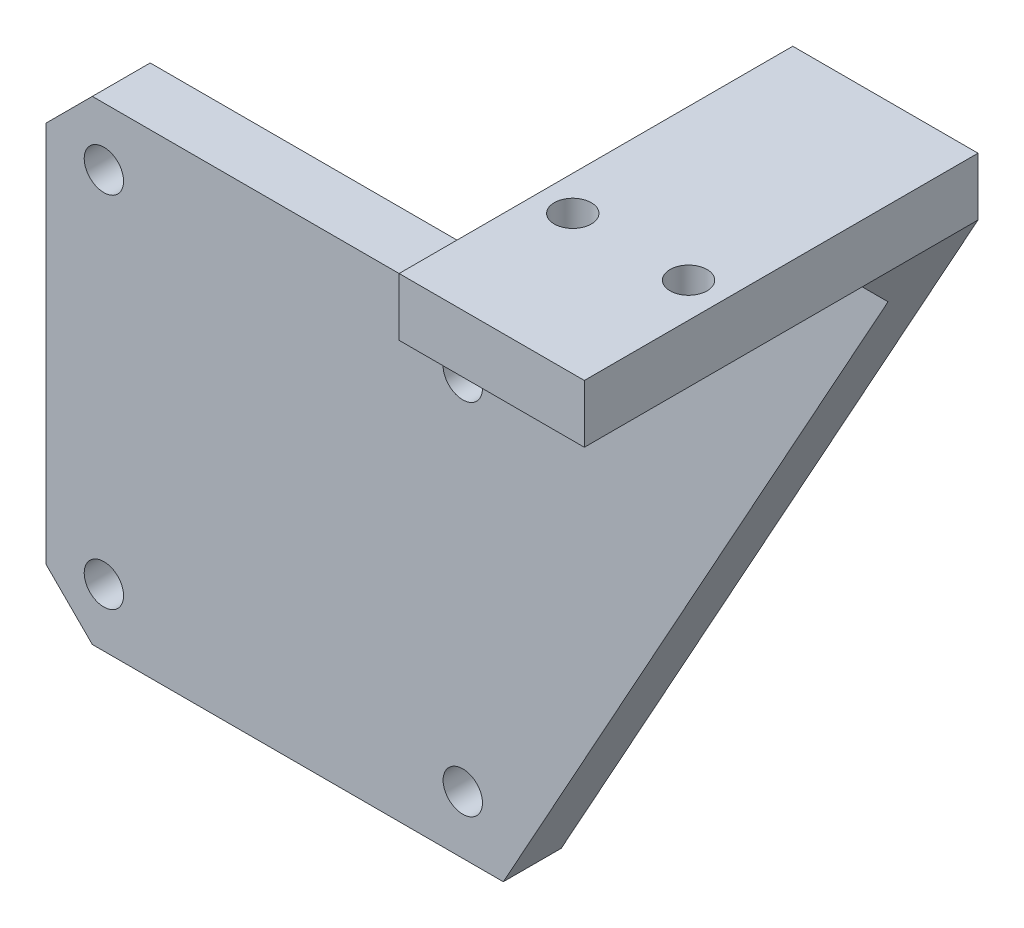
from build123d import *

# Parameters (mm, degrees)
P_IDAT_VYSUNUT_M1_DEPTH   = 4.999999888
ODEBRAT_VYSUNUT_M1_DEPTH  = 84.910666461
SKICA3_W                  = 16.00000076
SKICA3_H                  = 5.000002682
P_IDAT_VYSUNUT_M2_DEPTH   = 20
ODEBRAT_VYSUNUT_M3_DEPTH  = 87.116200856
ODEBRAT_VYSUNUT_M4_DEPTH  = 87.116200856
ODEBRAT_VYSUNUT_M5_DEPTH  = 87.116200856
ODEBRAT_VYSUNUT_M6_DEPTH  = 87.116200856
ZKOSEN_1_SIZE             = 4.000000656
ZKOSEN_2_SIZE             = 4.999998957
ZKOSEN_2_SIZE_2           = 4.999999888
ZKOSEN_3_SIZE             = 3.999999976
ZKOSEN_3_SIZE2            = 4.000000587
SKICA11_R                 = 1.7
ODEBRAT_VYSUNUT_M9_DEPTH  = 10
SKICA12_W                 = 16.00000076
SKICA12_H                 = 5.000002682
P_IDAT_VYSUNUT_M3_DEPTH   = 9
SKICA10_R                 = 1.6
SKICA10_R_2               = 1.599999993
ODEBRAT_VYSUNUT_M10_DEPTH = 9


with BuildPart() as part:
    # Skica1 → Přidat vysunutím1 (new body)
    with BuildSketch(Plane.XY.offset(4.999999888)):
        Polygon((45.999998971, 70.000000298), (-29.500000179, 70.000000298), (-29.500000179, 6.8e-07), (9.999999776, 6.8e-07), (45.999998971, 64.999998915), align=None)
    extrude(amount=-P_IDAT_VYSUNUT_M1_DEPTH)

    # Skica2 → Odebrat vysunutím1 (cut, through all)
    with BuildSketch(Plane.XY.offset(4.999999888)):
        Polygon((25.833334774, 59.999998659), (30.000000641, 64.999996523), (30.000000641, 70.000000298), (-29.500000179, 70.000000298), (-29.500000179, 41.000001132), (9.999999776, 41.000001132), align=None)
    extrude(amount=-ODEBRAT_VYSUNUT_M1_DEPTH, mode=Mode.SUBTRACT)

    # Skica3 → Přidat vysunutím2 (add)
    with BuildSketch(Plane.XY.offset(4.999999888)):
        with Locations((37.999999709, 67.499998957)):
            Rectangle(SKICA3_W, SKICA3_H)
    extrude(amount=P_IDAT_VYSUNUT_M2_DEPTH)

    # Skica5 → Odebrat vysunutím3 (cut, through all)
    with BuildSketch(Plane.XY.offset(4.999999888)):
        Polygon((-23.097474128, 4.468092229), (-23.010937497, 4.819194786), (-23.010937497, 5.180804525), (-23.097474128, 5.531907082), (-23.265523836, 5.85209718), (-23.505315185, 6.122766063), (-23.802915588, 6.328184158), (-24.141026661, 6.456412841), (-24.499999359, 6.500000134), (-24.85897392, 6.456412841), (-25.197084993, 6.328184158), (-25.494683534, 6.122766063), (-25.734476745, 5.85209718), (-25.90252459, 5.531907082), (-25.989063084, 5.180804525), (-25.989063084, 4.819194786), (-25.90252459, 4.468092229), (-25.734476745, 4.147903062), (-25.494683534, 3.877233714), (-25.197084993, 3.671815852), (-24.85897392, 3.543587169), (-24.499999359, 3.500000108), (-24.141026661, 3.543587169), (-23.802915588, 3.671815852), (-23.505315185, 3.877233714), (-23.265523836, 4.147903062), align=None)
    extrude(amount=-ODEBRAT_VYSUNUT_M3_DEPTH, mode=Mode.SUBTRACT)

    # Skica6 → Odebrat vysunutím4 (cut, through all)
    with BuildSketch(Plane.XY.offset(4.999999888)):
        Polygon((5.505315959, 3.877233714), (5.802914966, 3.671815852), (6.141026504, 3.543587169), (6.500000134, 3.500000108), (6.858973298, 3.543587169), (7.197084371, 3.671815852), (7.494683843, 3.877233714), (7.734475657, 4.147903062), (7.902524434, 4.468092229), (7.989062928, 4.819194786), (7.989062928, 5.180804525), (7.902524434, 5.531907082), (7.734475657, 5.85209718), (7.494683843, 6.122766063), (7.197084371, 6.328184158), (6.858973298, 6.456412841), (6.500000134, 6.500000134), (6.141026504, 6.456412841), (5.802914966, 6.328184158), (5.505315959, 6.122766063), (5.26552368, 5.85209718), (5.097475369, 5.531907082), (5.010936875, 5.180804525), (5.010936875, 4.819194786), (5.097475369, 4.468092229), (5.26552368, 4.147903062), align=None)
    extrude(amount=-ODEBRAT_VYSUNUT_M4_DEPTH, mode=Mode.SUBTRACT)

    # Skica7 → Odebrat vysunutím5 (cut, through all)
    with BuildSketch(Plane.XY.offset(4.999999888)):
        Polygon((-23.377234116, 35.005312413), (-23.171816021, 35.302914679), (-23.043585941, 35.641025752), (-23.000000045, 35.99999845), (-23.043585941, 36.358974874), (-23.171816021, 36.697082222), (-23.377234116, 36.994680762), (-23.647902533, 37.234473974), (-23.968091235, 37.402521819), (-24.319194257, 37.489064038), (-24.680804461, 37.489064038), (-25.031907484, 37.402521819), (-25.352096185, 37.234473974), (-25.622766465, 36.994680762), (-25.82818456, 36.697082222), (-25.956412777, 36.358974874), (-26.000000536, 35.99999845), (-25.956412777, 35.641025752), (-25.82818456, 35.302914679), (-25.622766465, 35.005312413), (-25.352096185, 34.765522927), (-25.031907484, 34.597471356), (-24.680804461, 34.510936588), (-24.319194257, 34.510936588), (-23.968091235, 34.597471356), (-23.647902533, 34.765522927), align=None)
    extrude(amount=-ODEBRAT_VYSUNUT_M5_DEPTH, mode=Mode.SUBTRACT)

    # Skica8 → Odebrat vysunutím6 (cut, through all)
    with BuildSketch(Plane.XY.offset(4.999999888)):
        Polygon((5.968092475, 34.597471356), (6.319194566, 34.510936588), (6.68080477, 34.510936588), (7.031906862, 34.597471356), (7.35209696, 34.765522927), (7.622765843, 35.005312413), (7.828184403, 35.302914679), (7.956412621, 35.641025752), (8.00000038, 35.99999845), (7.956412621, 36.358974874), (7.828184403, 36.697082222), (7.622765843, 36.994680762), (7.35209696, 37.234473974), (7.031906862, 37.402521819), (6.68080477, 37.489064038), (6.319194566, 37.489064038), (5.968092475, 37.402521819), (5.647902843, 37.234473974), (5.377233494, 36.994680762), (5.171815865, 36.697082222), (5.043587182, 36.358974874), (4.999999888, 35.99999845), (5.043587182, 35.641025752), (5.171815865, 35.302914679), (5.377233494, 35.005312413), (5.647902843, 34.765522927), align=None)
    extrude(amount=-ODEBRAT_VYSUNUT_M6_DEPTH, mode=Mode.SUBTRACT)

    # Zkosení1
    zkosen_1_edges = [part.edges().sort_by_distance(p)[0] for p in [
        (-29.500000179, 41.000001132, 2.499999944),
    ]]
    chamfer(zkosen_1_edges, length=ZKOSEN_1_SIZE)

    # Zkosení2
    # the kernel refuses this chamfer: 4.999999888, 4.999998957 mm, written as the material it adds along each edge
    with BuildSketch(Plane(origin=(58.858412936, 64.999997616, 4.999999888), x_dir=(0, -0.999621916702082, -0.027495884216655726), z_dir=(-1, 0, 0))) as zkosen_2_piece_1_section:
        Polygon((ZKOSEN_2_SIZE * 0.999621916686, ZKOSEN_2_SIZE * 0.0274958842162), (-ZKOSEN_2_SIZE_2 * 0.027495884218, ZKOSEN_2_SIZE_2 * 0.99962191675), (0, 0), align=None)
    zkosen_2_piece_1 = extrude(amount=41.716826979, mode=Mode.PRIVATE)
    zkosen_2_piece_1 = split(zkosen_2_piece_1, bisect_by=Plane(origin=(43.332283636, 60.183290695, 6.69217666), z_dir=(-0.8747913551064548, 0.4844998297533371, 0)), keep=Keep.TOP, mode=Mode.PRIVATE)
    zkosen_2_piece_1 = split(zkosen_2_piece_1, bisect_by=Plane(origin=(32.300745654, 67.760889889, 6.69217666), z_dir=(0.7682212055202173, -0.6401844885570597, 0)), keep=Keep.TOP, mode=Mode.PRIVATE)
    add(zkosen_2_piece_1)

    # Zkosení3
    zkosen_3_edges = [part.edges().sort_by_distance(p)[0] for p in [
        (-29.500000179, 6.8e-07, 2.499999944),
    ]]
    zkosen_3_side = [part.faces().sort_by_distance(p)[0] for p in [
        (-9.750000201, 6.8e-07, 2.499999944),
    ]]
    chamfer(zkosen_3_edges, length=ZKOSEN_3_SIZE, length2=ZKOSEN_3_SIZE2, reference=zkosen_3_side[0])

    # Skica11 → Odebrat vysunutím9 (cut)
    with BuildSketch(Plane(origin=(0, 0, 0), x_dir=(-1, 0, 0), z_dir=(0, 0, -1))):
        with Locations((-6.500000134, 35.99999845)):
            Circle(SKICA11_R)
        with Locations((24.499998894, 35.99999845)):
            Circle(SKICA11_R)
        with Locations((-6.500000134, 4.999999655)):
            Circle(SKICA11_R)
        with Locations((24.499999359, 4.999999655)):
            Circle(SKICA11_R)
    extrude(amount=-ODEBRAT_VYSUNUT_M9_DEPTH, mode=Mode.SUBTRACT)

    # Skica12 → Přidat vysunutím3 (add)
    with BuildSketch(Plane.XY.offset(24.999999888)):
        with Locations((37.999999709, 67.499998957)):
            Rectangle(SKICA12_W, SKICA12_H)
    extrude(amount=P_IDAT_VYSUNUT_M3_DEPTH)

    # Skica10 → Odebrat vysunutím10 (cut)
    with BuildSketch(Plane.XZ.offset(-64.999997616)):
        with Locations(Location((32.999999717, 21.999999776, 0), (0, 0, 270))):
            Circle(SKICA10_R)
        with Locations(Location((42.999999717, 21.999999776, 0), (0, 0, 270))):
            Circle(SKICA10_R_2)
    extrude(amount=-ODEBRAT_VYSUNUT_M10_DEPTH, mode=Mode.SUBTRACT)


solid = part.part
